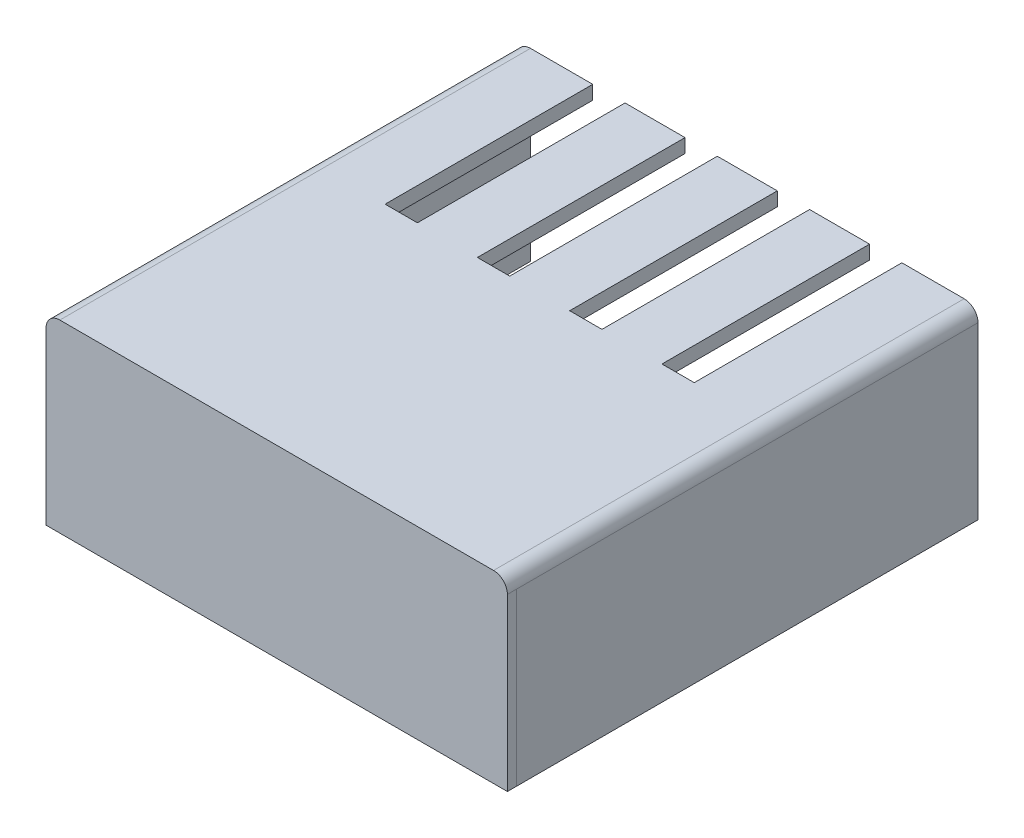
from build123d import *

# Parameters (mm, degrees)
CROQUIS1_W              = 100
CROQUIS1_H              = 102
SALIENTE_EXTRUIR1_DEPTH = 3
CROQUIS2_W              = 3
CROQUIS2_H              = 15
SALIENTE_EXTRUIR2_DEPTH = 50
CROQUIS3_W              = 3
CROQUIS3_H              = 46.5
CROQUIS3_H_2            = 40.5
SALIENTE_EXTRUIR3_DEPTH = 37
CROQUIS4_W              = 97
CROQUIS4_H              = 37
SALIENTE_EXTRUIR4_DEPTH = 2
CROQUIS5_W              = 100
CROQUIS5_H              = 37
SALIENTE_EXTRUIR5_DEPTH = 3
REDONDEO2_R             = 3
REDONDEO3_R             = 3
CROQUIS7_W              = 7
CROQUIS7_H              = 6
CORTAR_EXTRUIR1_DEPTH   = 45


with BuildPart() as part:
    # Croquis1 → Saliente-Extruir1 (new body)
    with BuildSketch(Plane(origin=(0, 0, 0), x_dir=(1, 0, 0), z_dir=(0, 1, 0))):
        with Locations((0, 19)):
            Rectangle(CROQUIS1_W, CROQUIS1_H)
    extrude(amount=SALIENTE_EXTRUIR1_DEPTH)

    # Croquis2 → Saliente-Extruir2 (add)
    with BuildSketch(Plane.XZ):
        with Locations((-48.5, -22)):
            Rectangle(CROQUIS2_W, CROQUIS2_H)
    extrude(amount=SALIENTE_EXTRUIR2_DEPTH)

    # Croquis3 → Saliente-Extruir3 (add)
    with BuildSketch(Plane.XZ):
        with Locations((-48.5, 8.75)):
            Rectangle(CROQUIS3_W, CROQUIS3_H)
        with Locations((-48.5, -49.75)):
            Rectangle(CROQUIS3_W, CROQUIS3_H_2)
    extrude(amount=SALIENTE_EXTRUIR3_DEPTH)

    # Croquis4 → Saliente-Extruir4 (add)
    with BuildSketch(Plane.XY.offset(32)):
        with Locations((1.5, -18.5)):
            Rectangle(CROQUIS4_W, CROQUIS4_H)
    extrude(amount=-SALIENTE_EXTRUIR4_DEPTH)

    # Redondeo2
    redondeo2_edges = [part.edges().sort_by_distance(p)[0] for p in [
        (50, 3, -19),
        (-50, 3, -19),
    ]]
    fillet(redondeo2_edges, radius=REDONDEO2_R)

    # Redondeo3
    redondeo3_edges = [part.edges().sort_by_distance(p)[0] for p in [
        (-47, -43.5, -29.5),
    ]]
    fillet(redondeo3_edges, radius=REDONDEO3_R - 0.0001)  # a hair under: the kernel refuses the full size

    # Croquis7 → Cortar-Extruir1 (cut)
    with BuildSketch(Plane(origin=(0, 0, -70), x_dir=(-1, 0, 0), z_dir=(0, 0, -1))):
        with Locations((30, 0)):
            Rectangle(CROQUIS7_W, CROQUIS7_H)
        with Locations((10, 0)):
            Rectangle(CROQUIS7_W, CROQUIS7_H)
        with Locations((-10, 0)):
            Rectangle(CROQUIS7_W, CROQUIS7_H)
        with Locations((-30, 0)):
            Rectangle(CROQUIS7_W, CROQUIS7_H)
    extrude(amount=-CORTAR_EXTRUIR1_DEPTH, mode=Mode.SUBTRACT)


with BuildPart() as body_2:
    # Croquis5 → Saliente-Extruir5 (new body)
    with BuildSketch(Plane(origin=(50, 0, 0), x_dir=(0, 0, -1), z_dir=(1, 0, 0))):
        with Locations((20, -18.5)):
            Rectangle(CROQUIS5_W, CROQUIS5_H)
    extrude(amount=-SALIENTE_EXTRUIR5_DEPTH)


solid = Compound([part.part, body_2.part])
